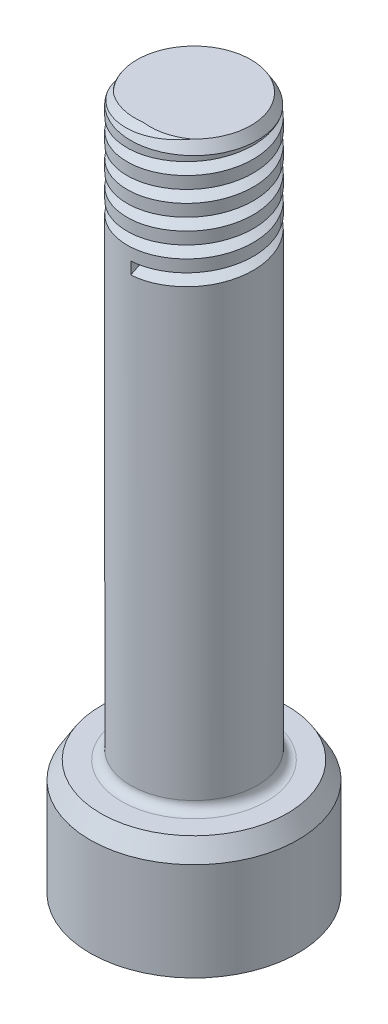
from build123d import *

# Parameters (mm, degrees)
CUT_SWEEP1_PITCH   = 0.793751588
CUT_EXTRUDE1_DEPTH = 1.955803912
FILLET1_R          = 0.30480061
FILLET2_R          = 0.396875794
CHAMFER3_SIZE      = 0.127


with BuildPart() as part:
    # Sketch1 → Revolve1 (revolve)
    with BuildSketch(Plane.XY, mode=Mode.PRIVATE) as revolve1_sk:
        Polygon((0, 0), (0, 23.215608331), (2.082804166, 23.215608331), (2.082804166, 4.165608331), (3.429006858, 4.165608331), (3.429006858, 0), align=None)
    revolve(revolve1_sk.sketch.rotate(Axis((0, 0, 0), (0, 1, 0)), 90), axis=Axis((0, 0, 0), (0, 1, 0)))

    # Cut-Sweep1: arcs per turn and ends read off the stored shape
    # Cut-Sweep1: the profile of Sketch3 profile screwed along a right-hand helix through 5.999989 turns, 8 arcs to a turn; built about Z, then put on its axis
    cut_sweep1_z = Axis((0, 0, 0), (0, 0, 1))
    cut_sweep1_corners = [(2.083104166, 0, -0.595163691), (2.083104166, 0, -0.992339484), (1.685928372, 0, -0.793751588)]
    with BuildLine(mode=Mode.PRIVATE) as cut_sweep1_profile:
        Line(cut_sweep1_corners[0], cut_sweep1_corners[1])
        Line(cut_sweep1_corners[1], cut_sweep1_corners[2])
        Line(cut_sweep1_corners[2], cut_sweep1_corners[0])
    cut_sweep1_cap = Face(cut_sweep1_profile.wire())
    cut_sweep1_turn_angles = [0, 22.5, 45, 67.5, 90, 112.5, 135, 157.5, 180, 202.5, 225, 247.5, 270, 292.5, 315, 337.5, 360]
    cut_sweep1_turn_weights = [1, 0.9238795325112867, 1, 0.9238795325112867, 1, 0.9238795325112867, 1, 0.9238795325112867, 1, 0.9238795325112867, 1, 0.9238795325112867, 1, 0.9238795325112867, 1, 0.9238795325112867, 1]
    cut_sweep1_turn_rails = [Edge.make_bspline([Vector(p[0], p[1], 0).rotate(cut_sweep1_z, cut_sweep1_turn_angles[k]) / cut_sweep1_turn_weights[k] + Vector(0, 0, p[2] + CUT_SWEEP1_PITCH * cut_sweep1_turn_angles[k] / 360) for k in range(17)], [0, 0, 0, 1, 1, 2, 2, 3, 3, 4, 4, 5, 5, 6, 6, 7, 7, 8, 8, 8], 2, cut_sweep1_turn_weights) for p in cut_sweep1_corners]
    cut_sweep1_turn_sides = [Face.make_surface_from_curves(cut_sweep1_turn_rails[p[0]], cut_sweep1_turn_rails[p[1]]) for p in [(0, 1), (1, 2), (2, 0)]]
    cut_sweep1_last_angles = [1800, 1822.5, 1845, 1867.5, 1890, 1912.5, 1935, 1957.5, 1980, 2002.5, 2025, 2047.5, 2070, 2092.5, 2115, 2137.498, 2159.996]
    cut_sweep1_last_weights = [1, 0.9238795325112867, 1, 0.9238795325112867, 1, 0.9238795325112867, 1, 0.9238795325112867, 1, 0.9238795325112867, 1, 0.9238795325112867, 1, 0.9238795325112867, 1, 0.9238928901201994, 1]
    cut_sweep1_last_rails = [Edge.make_bspline([Vector(p[0], p[1], 0).rotate(cut_sweep1_z, cut_sweep1_last_angles[k]) / cut_sweep1_last_weights[k] + Vector(0, 0, p[2] + CUT_SWEEP1_PITCH * cut_sweep1_last_angles[k] / 360) for k in range(17)], [0, 0, 0, 1, 1, 2, 2, 3, 3, 4, 4, 5, 5, 6, 6, 7, 7, 8, 8, 8], 2, cut_sweep1_last_weights) for p in cut_sweep1_corners]
    cut_sweep1_last_sides = [Face.make_surface_from_curves(cut_sweep1_last_rails[p[0]], cut_sweep1_last_rails[p[1]]) for p in [(0, 1), (1, 2), (2, 0)]]
    cut_sweep1 = Plane(origin=(0, 23.215608331, 0), x_dir=(0, 0, 1), z_dir=(0, -1, 0)) * Solid(Shell([*[p.moved(Location((0, 0, CUT_SWEEP1_PITCH * i))) for i in range(5) for p in cut_sweep1_turn_sides], *cut_sweep1_last_sides, cut_sweep1_cap, cut_sweep1_cap.rotate(cut_sweep1_z, 2159.996).moved(Location((0, 0, CUT_SWEEP1_PITCH * 2159.996 / 360)))]))
    add(cut_sweep1, mode=Mode.SUBTRACT)

    # Sketch4 → Cut-Extrude1 (cut)
    with BuildSketch(Plane(origin=(0, 0, 0), x_dir=(1, 0, 0), z_dir=(0, 1, 0))):
        Polygon((0, 2.06772639), (-1.790703581, 1.033863195), (-1.790703581, -1.033863195), (0, -2.06772639), (1.790703581, -1.033863195), (1.790703581, 1.033863195), align=None)
    extrude(amount=CUT_EXTRUDE1_DEPTH, mode=Mode.SUBTRACT)

    # Fillet1
    fillet1_edges = [part.edges().sort_by_distance(p)[0] for p in [
        (0, 4.165608331, 2.082804166),
    ]]
    fillet(fillet1_edges, radius=FILLET1_R)

    # Fillet2
    fillet2_edges = [part.edges().sort_by_distance(p)[0] for p in [
        (1.790703581, 0.977901956, -1.033863195),
        (0, 0.977901956, -2.06772639),
        (-1.790703581, 0.977901956, -1.033863195),
        (-1.790703581, 0.977901956, 1.033863195),
        (0, 0.977901956, 2.06772639),
        (1.790703581, 0.977901956, 1.033863195),
        (0.895351791, 1.955803912, -1.550794792),
        (-0.895351791, 1.955803912, -1.550794792),
        (-1.790703581, 1.955803912, 0),
        (-0.895351791, 1.955803912, 1.550794792),
        (0.895351791, 1.955803912, 1.550794792),
        (1.790703581, 1.955803912, 0),
    ]]
    fillet(fillet2_edges, radius=FILLET2_R)

    # Chamfer1: read off the stored shape, not the designer's step
    # Chamfer1 outline → Chamfer1 (revolve, cut)
    with BuildSketch(Plane.XY):
        Polygon((2.082804166, 23.215608331), (1.879603759, 23.215608331), (2.082804166, 22.886469354), align=None)
    revolve(axis=Axis((0, 0, 0), (0, 1, 0)), mode=Mode.SUBTRACT)

    # Chamfer2: read off the stored shape, not the designer's step
    # Chamfer2 outline → Chamfer2 (revolve, cut)
    with BuildSketch(Plane.XY):
        Polygon((2.853013648, 0), (3.429006858, 0), (3.429006858, 0.355600711), align=None)
        Polygon((3.073406147, 4.165608331), (3.429006858, 3.589615121), (3.429006858, 4.165608331), align=None)
    revolve(axis=Axis((0, 0, 0), (0, 1, 0)), mode=Mode.SUBTRACT)

    # Chamfer3
    chamfer3_edges = [part.edges().sort_by_distance(p)[0] for p in [
        (0.895351791, 0, -1.550794792),
        (-0.895351791, 0, -1.550794792),
        (-1.790703581, 0, 0),
        (-0.895351791, 0, 1.550794792),
        (0.895351791, 0, 1.550794792),
        (1.790703581, 0, 0),
        (0, 0, -2.006329491),
        (1.737532307, 0, -1.003164745),
        (1.737532307, 0, 1.003164745),
        (0, 0, 2.006329491),
        (-1.737532307, 0, 1.003164745),
        (-1.737532307, 0, -1.003164745),
    ]]
    chamfer(chamfer3_edges, length=CHAMFER3_SIZE)


solid = part.part
